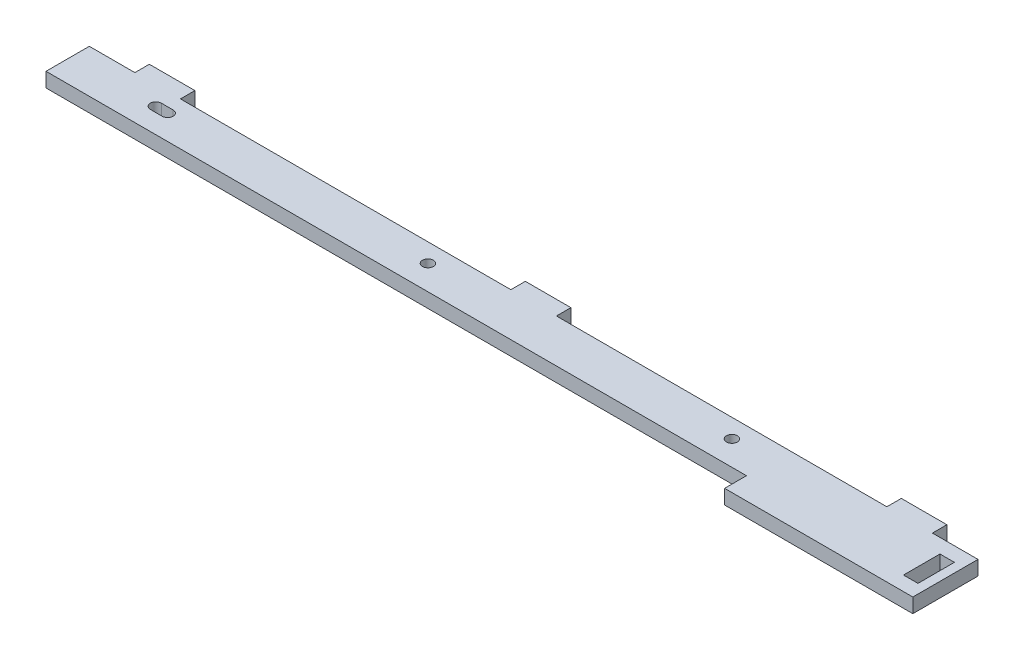
from build123d import *

# Parameters (mm, degrees)
SKETCH1_W                = 195
SKETCH1_H                = 9.5
BOSS_EXTRUDE1_DEPTH      = 3.175
M2_CLEARANCE_HOLE1_D     = 2.4
SKETCH5_W                = 10
SKETCH5_H                = 3.175
BOSS_EXTRUDE2_DEPTH      = 3.175
SKETCH6_W                = 41.3
SKETCH6_H                = 3.175
BOSS_EXTRUDE3_DEPTH      = 4.8
SKETCH7_W                = 3.175
SKETCH7_H                = 8
CUT_EXTRUDE1_DEPTH       = 99.01802449
M2_CLEARANCE_SLOT1_DEPTH = 3.175


# Read off the part's stored shape, not the designer's step: M2 Clearance Slot1
with BuildPart() as part:
    # Sketch1 → Boss-Extrude1 (new body)
    with BuildSketch(Plane(origin=(0, 0, 0), x_dir=(1, 0, 0), z_dir=(0, 1, 0))):
        Rectangle(SKETCH1_W, SKETCH1_H)
    extrude(amount=BOSS_EXTRUDE1_DEPTH)

    # M2 Clearance Hole1 (through all)
    with Locations(Plane(origin=(0, 3.175, 0), x_dir=(1, 0, 0), z_dir=(0, 1, 0))):
        with Locations((-77.5, 0.65), (47.6, 0.65), (-19.1, 0.65)):
            Hole(M2_CLEARANCE_HOLE1_D / 2)

    # Sketch5 → Boss-Extrude2 (add)
    with BuildSketch(Plane(origin=(0, 0, -4.75), x_dir=(-1, 0, 0), z_dir=(0, 0, -1))):
        with Locations((82.5, 1.5875)):
            Rectangle(SKETCH5_W, SKETCH5_H)
        with Locations((-82.5, 1.5875)):
            Rectangle(SKETCH5_W, SKETCH5_H)
        with Locations((0, 1.5875)):
            Rectangle(SKETCH5_W, SKETCH5_H)
    extrude(amount=BOSS_EXTRUDE2_DEPTH)

    # Sketch6 → Boss-Extrude3 (add)
    with BuildSketch(Plane.XY.offset(4.75)):
        with Locations((76.85, 1.5875)):
            Rectangle(SKETCH6_W, SKETCH6_H)
    extrude(amount=BOSS_EXTRUDE3_DEPTH)

    # Sketch7 → Cut-Extrude1 (cut, through all)
    with BuildSketch(Plane(origin=(0, 3.175, 0), x_dir=(1, 0, 0), z_dir=(0, 1, 0))):
        with Locations((93.8875, -2.4)):
            Rectangle(SKETCH7_W, SKETCH7_H)
    extrude(amount=-CUT_EXTRUDE1_DEPTH, mode=Mode.SUBTRACT)

    # M2 Clearance Slot1 outline → M2 Clearance Slot1 (cut)
    with BuildSketch(Plane(origin=(0, 0, 0), x_dir=(1, 0, 0), z_dir=(0, 1, 0))):
        with BuildLine():
            ThreePointArc((-78.8, 1.85), (-80, 0.65), (-78.8, -0.55))
            Line((-78.8, -0.55), (-77.5, -0.55))
            ThreePointArc((-77.5, -0.55), (-78.7, 0.65), (-77.5, 1.85))
            Line((-77.5, 1.85), (-78.8, 1.85))
        make_face()
        with BuildLine():
            ThreePointArc((-77.5, 1.85), (-76.3, 0.65), (-77.5, -0.55))
            Line((-77.5, -0.55), (-76.2, -0.55))
            ThreePointArc((-76.2, -0.55), (-75, 0.65), (-76.2, 1.85))
            Line((-76.2, 1.85), (-77.5, 1.85))
        make_face()
    extrude(amount=M2_CLEARANCE_SLOT1_DEPTH, mode=Mode.SUBTRACT)


solid = part.part
